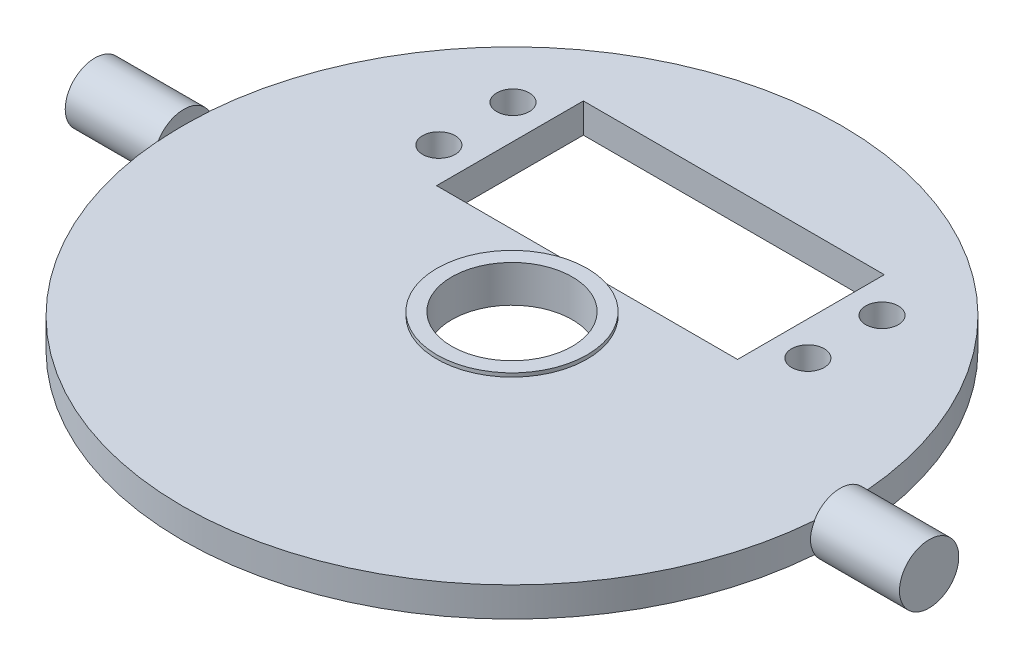
from build123d import *

# Parameters (mm, degrees)
SKETCH1_R               = 10.125
BOSS_EXTRUDE1_DEPTH     = 2
SKETCH1_7_R             = 10.125
SKETCH1_7_R_2           = 8.125
BOSS_EXTRUDE2_DEPTH     = 2.5
SKETCH2_W               = 40.6
SKETCH2_H               = 19.8
CUT_EXTRUDE1_DEPTH      = 72.958854778
CUT_EXTRUDE2_DEPTH      = 72.958854778
CUT_EXTRUDE2_DEPTH_BACK = 72.958854778
SKETCH3_R               = 2.2


with BuildPart() as part:
    # Sketch1 → Boss-Extrude1 (new, symmetric)
    with BuildSketch(Plane(origin=(0, 0, 0), x_dir=(1, 0, 0), z_dir=(0, 1, 0))):
        with BuildLine():
            ThreePointArc((44.269656651, 4), (0, 44.45), (-44.269656651, 4))
            ThreePointArc((-44.269656651, 4), (-44.404891274, 2.002031701), (-44.45, 0))
            ThreePointArc((-44.45, 0), (-44.404891274, -2.002031701), (-44.269656651, -4))
            ThreePointArc((-44.269656651, -4), (0, -44.45), (44.269656651, -4))
            ThreePointArc((44.269656651, -4), (44.404891274, -2.002031701), (44.45, 0))
            ThreePointArc((44.45, 0), (44.404891274, 2.002031701), (44.269656651, 4))
        make_face()
        Circle(SKETCH1_R, mode=Mode.SUBTRACT)
    extrude(amount=BOSS_EXTRUDE1_DEPTH, both=True)

    # Sketch1<6> → Revolve1 (revolve)
    with BuildSketch(Plane(origin=(0, 0, 0), x_dir=(1, 0, 0), z_dir=(0, 1, 0))):
        with BuildLine():
            Line((-44.45, 0), (-56.269656651, 0))
            Line((-56.269656651, 0), (-56.269656651, -4))
            Line((-56.269656651, -4), (-44.269656651, -4))
            ThreePointArc((-44.269656651, -4), (-44.404891274, -2.002031701), (-44.45, 0))
        make_face()
        with BuildLine():
            Line((56.269656651, 0), (44.45, 0))
            ThreePointArc((44.45, 0), (44.404891274, -2.002031701), (44.269656651, -4))
            Line((44.269656651, -4), (56.269656651, -4))
            Line((56.269656651, -4), (56.269656651, 0))
        make_face()
    revolve(axis=Axis((-76.43543075, 0, 0), (1, 0, 0)))

    # Sketch1<7> → Boss-Extrude2 (add, symmetric)
    with BuildSketch(Plane(origin=(0, 0, 0), x_dir=(1, 0, 0), z_dir=(0, 1, 0))):
        Circle(SKETCH1_7_R)
        Circle(SKETCH1_7_R_2, mode=Mode.SUBTRACT)
    extrude(amount=BOSS_EXTRUDE2_DEPTH, both=True)

    # Sketch2 → Cut-Extrude1 (cut, through all)
    with BuildSketch(Plane(origin=(0, 2, 0), x_dir=(1, 0, 0), z_dir=(0, 1, 0))):
        with Locations((0, 20.025)):
            Rectangle(SKETCH2_W, SKETCH2_H)
    extrude(amount=-CUT_EXTRUDE1_DEPTH, mode=Mode.SUBTRACT)

    # Sketch3 → Cut-Extrude2 (cut, two sides: drawn at the far end of the back side and taken through both)
    with BuildSketch(Plane.XZ.offset(2).offset(-CUT_EXTRUDE2_DEPTH_BACK)):
        with Locations((24.889613301, -15.025)):
            Circle(SKETCH3_R)
        with Locations((24.889613301, -25.025)):
            Circle(SKETCH3_R)
        with Locations((-24.889613301, -15.025)):
            Circle(SKETCH3_R)
        with Locations((-24.889613301, -25.025)):
            Circle(SKETCH3_R)
    extrude(amount=CUT_EXTRUDE2_DEPTH + CUT_EXTRUDE2_DEPTH_BACK, mode=Mode.SUBTRACT)


solid = part.part
